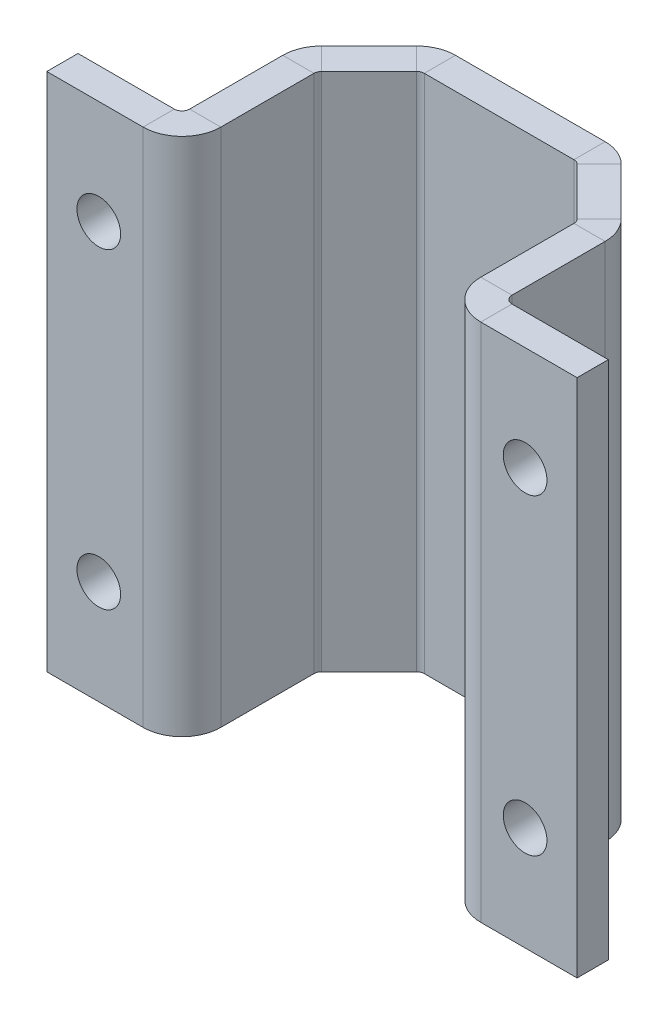
from build123d import *

# Parameters (mm, degrees)
SKETCH1_W                      = 15
SKETCH1_H                      = 50
BASE_FLANGE1_DEPTH             = 3
EDGE_FLANGE5_STRIP_CUT_DEPTH   = 50
EDGE_FLANGE5_STRIP_CUT_2_DEPTH = 50
EDGE_FLANGE5_DEPTH             = 50
EDGE_FLANGE5_BEND_DEPTH        = 50
EDGE_FLANGE6_STRIP_CUT_DEPTH   = 50
EDGE_FLANGE6_STRIP_CUT_2_DEPTH = 50
EDGE_FLANGE6_DEPTH             = 50
EDGE_FLANGE6_BEND_DEPTH        = 50
EDGE_FLANGE7_STRIP_W           = 13.4732
EDGE_FLANGE7_STRIP_H           = 3
EDGE_FLANGE7_STRIP_CUT_DEPTH   = 50
EDGE_FLANGE7_STRIP_2_W         = 13.4732
EDGE_FLANGE7_STRIP_2_H         = 3
EDGE_FLANGE7_STRIP_CUT_2_DEPTH = 50
EDGE_FLANGE7_DEPTH             = 50
EDGE_FLANGE7_BEND_DEPTH        = 50
TAP_DRILL_FOR_M5X0_8_TAP1_D    = 4.2


# Sheet-metal steps are written as plain solids
with BuildPart() as part:
    # Sketch1 → Base-Flange1 (new body)
    with BuildSketch(Plane.XY):
        with Locations((7.5, 25)):
            Rectangle(SKETCH1_W, SKETCH1_H)
    extrude(amount=-BASE_FLANGE1_DEPTH)

    # Edge-Flange5 strip (across the edge) → Edge-Flange5 strip cut (cut)
    with BuildSketch(Plane(origin=(15, 0, 0), x_dir=(-0.7071067811865438, 0, 0.7071067811865512), z_dir=(0, 1, 0))):
        Polygon((-11.432566283, 7.189925596), (-1.905575199, -2.337065489), (0.215745145, -0.215745145), (-9.311245939, 9.311245939), align=None)
    extrude(amount=EDGE_FLANGE5_STRIP_CUT_DEPTH, mode=Mode.SUBTRACT)

    # Edge-Flange5 strip 2 (across the edge) → Edge-Flange5 strip cut 2 (cut)
    with BuildSketch(Plane(origin=(0, 50, 0), x_dir=(0.7071067811865438, 0, 0.7071067811865512), z_dir=(0, -1, 0))):
        Polygon((-11.432566283, 7.189925596), (-1.905575199, -2.337065489), (0.215745145, -0.215745145), (-9.311245939, 9.311245939), align=None)
    extrude(amount=EDGE_FLANGE5_STRIP_CUT_2_DEPTH, mode=Mode.SUBTRACT)

    # Edge-Flange5 section (across the edge) → Edge-Flange5 (add)
    with BuildSketch(Plane(origin=(15, 0, 0), x_dir=(-0.7071067811865438, 0, 0.7071067811865512), z_dir=(0, 1, 0))):
        with BuildLine():
            Line((-3, 0.30510971), (-3, 7.071))
            Line((-3, 7.071), (0, 7.071))
            Line((0, 7.071), (0, 0.30510971))
            ThreePointArc((0, 0.30510971), (0.056070336, 0.023225094), (0.215745145, -0.215745145))
            Line((0.215745145, -0.215745145), (-1.905575199, -2.337065489))
            ThreePointArc((-1.905575199, -2.337065489), (-2.715568261, -1.124825203), (-3, 0.30510971))
        make_face()
    extrude(amount=EDGE_FLANGE5_DEPTH)

    # Edge-Flange5 section 2 (across the edge) → Edge-Flange5 bend (add)
    with BuildSketch(Plane(origin=(0, 50, 0), x_dir=(0.7071067811865438, 0, 0.7071067811865512), z_dir=(0, -1, 0))):
        with BuildLine():
            Line((-3, 0.30510971), (-3, 7.071))
            Line((-3, 7.071), (0, 7.071))
            Line((0, 7.071), (0, 0.30510971))
            ThreePointArc((0, 0.30510971), (0.056070336, 0.023225094), (0.215745145, -0.215745145))
            Line((0.215745145, -0.215745145), (-1.905575199, -2.337065489))
            ThreePointArc((-1.905575199, -2.337065489), (-2.715568261, -1.124825203), (-3, 0.30510971))
        make_face()
    extrude(amount=EDGE_FLANGE5_BEND_DEPTH)

    # Edge-Flange6 strip (across the edge) → Edge-Flange6 strip cut (cut)
    with BuildSketch(Plane(origin=(-4.99995205, 50, 4.99995205), x_dir=(1, 0, 0), z_dir=(0, -1, 0))):
        Polygon((-11.432566283, 7.189925596), (-1.905575199, -2.337065489), (0.215745145, -0.215745145), (-9.311245939, 9.311245939), align=None)
    extrude(amount=EDGE_FLANGE6_STRIP_CUT_DEPTH, mode=Mode.SUBTRACT)

    # Edge-Flange6 strip 2 (across the edge) → Edge-Flange6 strip cut 2 (cut)
    with BuildSketch(Plane(origin=(19.99995205, 0, 4.99995205), x_dir=(-1, 0, 0), z_dir=(0, 1, 0))):
        Polygon((-11.432566283, 7.189925596), (-1.905575199, -2.337065489), (0.215745145, -0.215745145), (-9.311245939, 9.311245939), align=None)
    extrude(amount=EDGE_FLANGE6_STRIP_CUT_2_DEPTH, mode=Mode.SUBTRACT)

    # Edge-Flange6 section (across the edge) → Edge-Flange6 (add)
    with BuildSketch(Plane(origin=(-4.99995205, 50, 4.99995205), x_dir=(1, 0, 0), z_dir=(0, -1, 0))):
        with BuildLine():
            Line((-3, 0.30510971), (-3, 10))
            Line((-3, 10), (0, 10))
            Line((0, 10), (0, 0.30510971))
            ThreePointArc((0, 0.30510971), (0.056070336, 0.023225094), (0.215745145, -0.215745145))
            Line((0.215745145, -0.215745145), (-1.905575199, -2.337065489))
            ThreePointArc((-1.905575199, -2.337065489), (-2.715568261, -1.124825203), (-3, 0.30510971))
        make_face()
    extrude(amount=EDGE_FLANGE6_DEPTH)

    # Edge-Flange6 section 2 (across the edge) → Edge-Flange6 bend (add)
    with BuildSketch(Plane(origin=(19.99995205, 0, 4.99995205), x_dir=(-1, 0, 0), z_dir=(0, 1, 0))):
        with BuildLine():
            Line((-3, 0.30510971), (-3, 10))
            Line((-3, 10), (0, 10))
            Line((0, 10), (0, 0.30510971))
            ThreePointArc((0, 0.30510971), (0.056070336, 0.023225094), (0.215745145, -0.215745145))
            Line((0.215745145, -0.215745145), (-1.905575199, -2.337065489))
            ThreePointArc((-1.905575199, -2.337065489), (-2.715568261, -1.124825203), (-3, 0.30510971))
        make_face()
    extrude(amount=EDGE_FLANGE6_BEND_DEPTH)

    # Edge-Flange7 strip (across the edge) → Edge-Flange7 strip cut (cut)
    with BuildSketch(Plane(origin=(-7.99995205, 0, 14.99995205), x_dir=(0, 0, -1), z_dir=(0, 1, 0))):
        with Locations((-6, -1.5)):
            Rectangle(EDGE_FLANGE7_STRIP_W, EDGE_FLANGE7_STRIP_H)
    extrude(amount=EDGE_FLANGE7_STRIP_CUT_DEPTH, mode=Mode.SUBTRACT)

    # Edge-Flange7 strip 2 (across the edge) → Edge-Flange7 strip cut 2 (cut)
    with BuildSketch(Plane(origin=(22.99995205, 50, 14.99995205), x_dir=(0, 0, -1), z_dir=(0, -1, 0))):
        with Locations((-6, -1.5)):
            Rectangle(EDGE_FLANGE7_STRIP_2_W, EDGE_FLANGE7_STRIP_2_H)
    extrude(amount=EDGE_FLANGE7_STRIP_CUT_2_DEPTH, mode=Mode.SUBTRACT)

    # Edge-Flange7 section (across the edge) → Edge-Flange7 (add)
    with BuildSketch(Plane(origin=(-7.99995205, 0, 14.99995205), x_dir=(0, 0, -1), z_dir=(0, 1, 0))):
        with BuildLine():
            Line((-3, 0.7366), (-3, 10))
            Line((-3, 10), (0, 10))
            Line((0, 10), (0, 0.7366))
            ThreePointArc((0, 0.7366), (0.215745145, 0.215745145), (0.7366, 0))
            Line((0.7366, 0), (0.7366, -3))
            ThreePointArc((0.7366, -3), (-1.905575199, -1.905575199), (-3, 0.7366))
        make_face()
    extrude(amount=EDGE_FLANGE7_DEPTH)

    # Edge-Flange7 section 2 (across the edge) → Edge-Flange7 bend (add)
    with BuildSketch(Plane(origin=(22.99995205, 50, 14.99995205), x_dir=(0, 0, -1), z_dir=(0, -1, 0))):
        with BuildLine():
            Line((-3, 0.7366), (-3, 10))
            Line((-3, 10), (0, 10))
            Line((0, 10), (0, 0.7366))
            ThreePointArc((0, 0.7366), (0.215745145, 0.215745145), (0.7366, 0))
            Line((0.7366, 0), (0.7366, -3))
            ThreePointArc((0.7366, -3), (-1.905575199, -1.905575199), (-3, 0.7366))
        make_face()
    extrude(amount=EDGE_FLANGE7_BEND_DEPTH)

    # Tap Drill for M5x0.8 Tap1 (through all)
    with Locations(Plane.XY.offset(17.99995205)):
        with Locations((-12.99995205, 10), (-12.99995205, 40), (27.99995205, 10), (27.99995205, 40)):
            Hole(TAP_DRILL_FOR_M5X0_8_TAP1_D / 2)


solid = part.part
